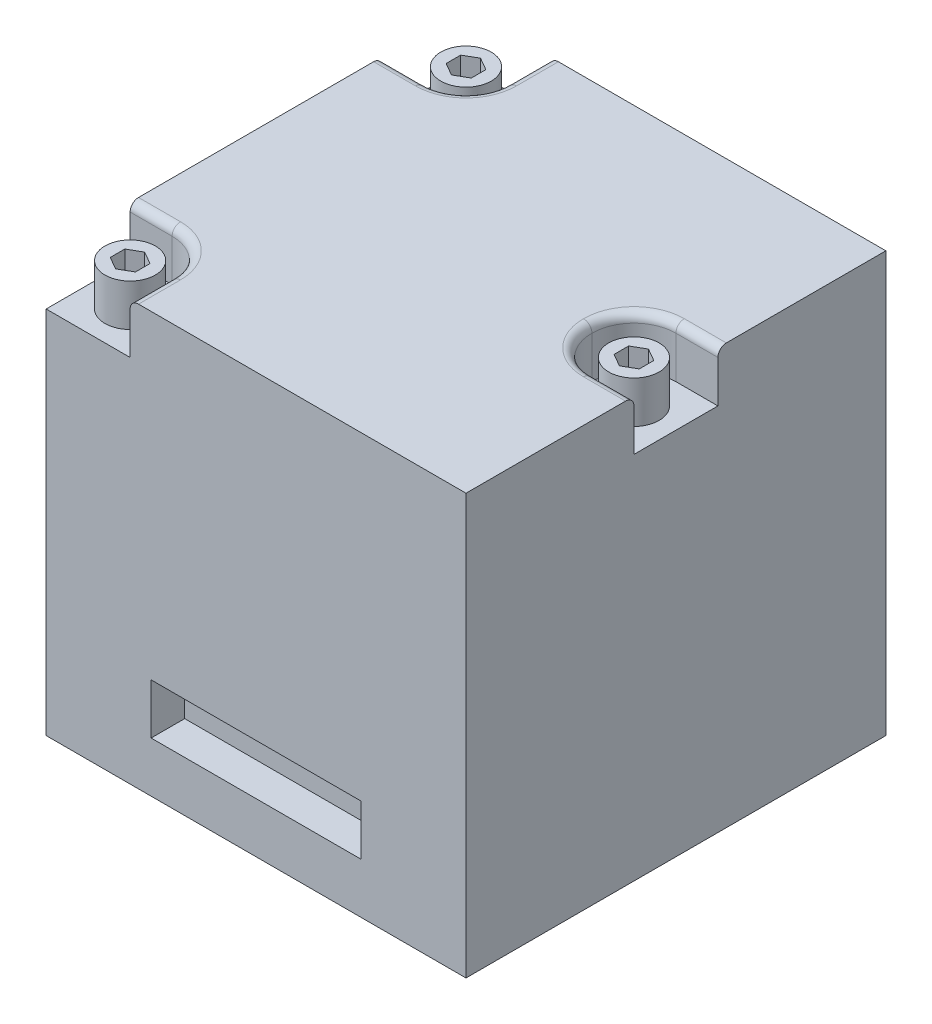
from build123d import *

# Parameters (mm, degrees)
SKETCH1_W           = 50
SKETCH1_H           = 50
BOSS_EXTRUDE1_DEPTH = 50
SKETCH2_W           = 10
SKETCH2_H           = 10
CUT_EXTRUDE1_DEPTH  = 6
FILLET1_R           = 5
FILLET2_R           = 1
SKETCH4_R           = 3
BOSS_EXTRUDE2_DEPTH = 5
CUT_EXTRUDE2_DEPTH  = 4
SKETCH6_W           = 25
SKETCH6_H           = 6
CUT_EXTRUDE3_DEPTH  = 4


with BuildPart() as part:
    # Sketch1 → Boss-Extrude1 (new body)
    with BuildSketch(Plane.XY):
        Rectangle(SKETCH1_W, SKETCH1_H)
    extrude(amount=BOSS_EXTRUDE1_DEPTH)

    # Sketch2 → Cut-Extrude1 (cut)
    with BuildSketch(Plane(origin=(0, 25, 0), x_dir=(1, 0, 0), z_dir=(0, 1, 0))):
        with Locations((-20, -5)):
            Rectangle(SKETCH2_W, SKETCH2_H)
        with Locations((-20, -45)):
            Rectangle(SKETCH2_W, SKETCH2_H)
        with Locations((20, -25)):
            Rectangle(SKETCH2_W, SKETCH2_H)
    extrude(amount=-CUT_EXTRUDE1_DEPTH, mode=Mode.SUBTRACT)

    # Fillet1
    fillet1_edges = [part.edges().sort_by_distance(p)[0] for p in [
        (15, 22, 30),
        (15, 22, 20),
        (-15, 22, 40),
        (-15, 22, 10),
    ]]
    fillet(fillet1_edges, radius=FILLET1_R - 0.0001)  # a hair under: the kernel refuses the full size

    # Fillet2
    fillet2_edges = [part.edges().sort_by_distance(p)[0] for p in [
        (-22.49995, 25, 10),
        (-15, 25, 47.49995),
        (22.49995, 25, 20),
        (22.49995, 25, 30),
        (-22.49995, 25, 40),
        (-15, 25, 2.50005),
        (16.464436805, 25, 28.535563195),
        (16.464436805, 25, 21.464436805),
        (-16.464436805, 25, 41.464436805),
        (-16.464436805, 25, 8.535563195),
    ]]
    fillet(fillet2_edges, radius=FILLET2_R)

    # Sketch4 → Boss-Extrude2 (add)
    with BuildSketch(Plane(origin=(0, 19, 0), x_dir=(1, 0, 0), z_dir=(0, 1, 0))):
        with Locations(Location((-20, -5, 0), (0, 0, 270))):
            Circle(SKETCH4_R)
        with Locations(Location((-20, -45, 0), (0, 0, 90))):
            Circle(SKETCH4_R)
        with Locations(Location((20, -25, 0), (0, 0, 90))):
            Circle(SKETCH4_R)
    extrude(amount=BOSS_EXTRUDE2_DEPTH)

    # Sketch5 → Cut-Extrude2 (cut)
    with BuildSketch(Plane(origin=(0, 24, 0), x_dir=(1, 0, 0), z_dir=(0, 1, 0))):
        Polygon((-20, -3.267949192), (-21.5, -4.133974596), (-21.5, -5.866025404), (-20, -6.732050808), (-18.5, -5.866025404), (-18.5, -4.133974596), align=None)
        Polygon((-20, -43.267949192), (-21.5, -44.133974596), (-21.5, -45.866025404), (-20, -46.732050808), (-18.5, -45.866025404), (-18.5, -44.133974596), align=None)
        Polygon((20, -23.267949192), (18.5, -24.133974596), (18.5, -25.866025404), (20, -26.732050808), (21.5, -25.866025404), (21.5, -24.133974596), align=None)
    extrude(amount=-CUT_EXTRUDE2_DEPTH, mode=Mode.SUBTRACT)

    # Sketch6 → Cut-Extrude3 (cut)
    with BuildSketch(Plane.XY.offset(50)):
        with Locations((0, -16)):
            Rectangle(SKETCH6_W, SKETCH6_H)
    extrude(amount=-CUT_EXTRUDE3_DEPTH, mode=Mode.SUBTRACT)


solid = part.part
